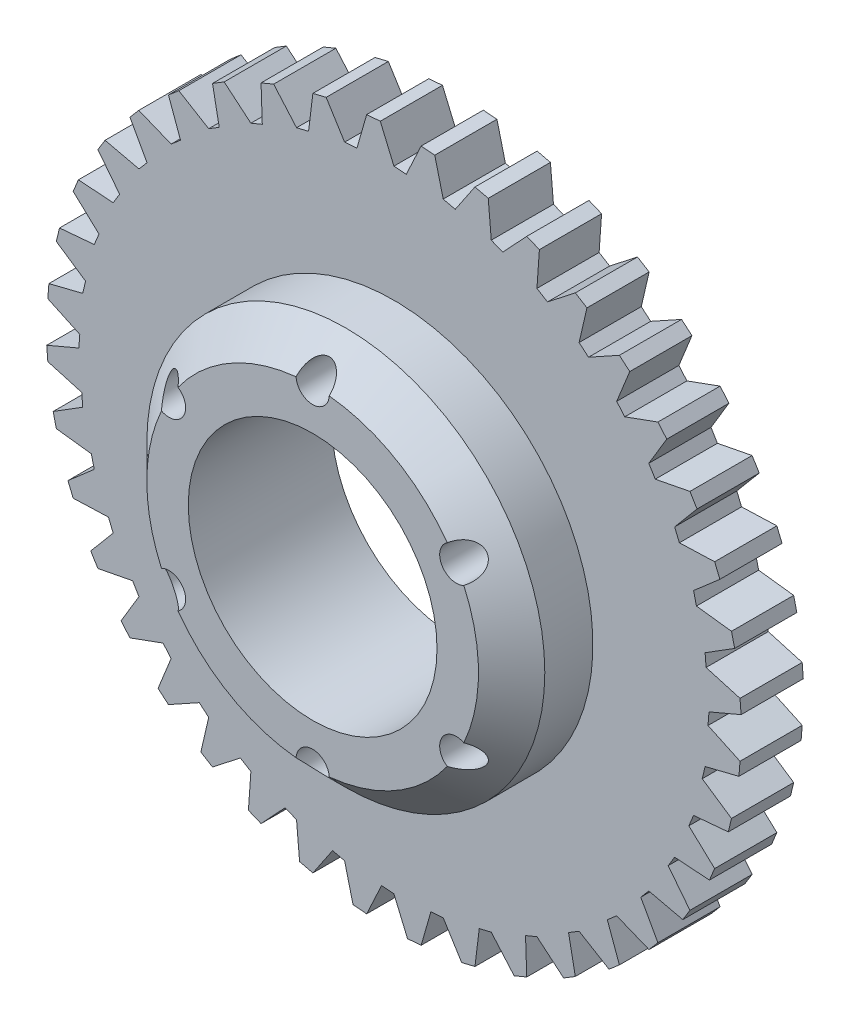
from build123d import *

# Parameters (mm, degrees)
BOSS_EXTRUDE1_DEPTH     = 3750
SCALE1_SCALE            = 0.001
SKETCH5_R               = 12
BOSS_EXTRUDE2_DEPTH     = 4.9
CUT_EXTRUDE1_DEPTH      = 20965.780474234
CUT_EXTRUDE1_DEPTH_BACK = 20965.780474234
SKETCH3_R               = 7.5
SKETCH3_R_2             = 1
CHAMFER1_SIZE           = 2


# Read off the part's stored shape, not the designer's step: Imported1
with BuildPart() as part:
    # Sketch1 → Boss-Extrude1 (new body)
    with BuildSketch(Plane.XY):
        Polygon((2322.933197021, 29515.665054321), (3051.04804039, 27515.468597412), (2484.270811081, 27031.394958496), (535.028636456, 27819.169998169), (-2e-09, 27192.7318573), (1032.050251961, 25331.064224243), (547.976732254, 24764.28604126), (-1500.502228737, 25237.434387207), (-1930.947303772, 24535.011291504), (-620.374023914, 22857.711791992), (-1009.82427597, 22222.185134888), (-3107.0997715, 22369.05670166), (-3422.362327576, 21607.944488525), (-1865.536689758, 20156.312942505), (-2150.774240494, 19467.68951416), (-4245.2044487, 19284.664154053), (-4437.521457672, 18483.606338501), (-2672.77765274, 17293.388366699), (-2846.778869629, 16568.620681763), (-4886.791706085, 16060.209274292), (-4951.427936554, 15238.927841187), (-3022.219896317, 14339.429855347), (-3080.700397491, 13596.36592865), (-5016.064167023, 12775.085449219), (-4951.427936554, 11953.804016113), (-2905.259132385, 11367.175102234), (-2846.778869629, 10624.111175537), (-4629.838466644, 9510.184288025), (-4437.521457672, 8709.126472473), (-2324.775218964, 8449.810028076), (-2150.774240494, 7725.043296814), (-3737.624645233, 6345.898628235), (-3422.362327576, 5584.787845612), (-1295.061826706, 5659.171104431), (-1009.82427597, 4970.546722412), (-2361.392259598, 3360.14342308), (-1930.947303772, 2657.721042633), (158.526480198, 3063.97151947), (547.976732254, 2428.446531296), (-535.028636456, 626.43802166), (0, 0), (2000.197172165, 728.114783764), (2484.270811081, 161.337509751), (1696.495294571, -1787.904620171), (2322.933197021, -2322.933197021), (4184.602737427, -1290.88306427), (4751.379966736, -1774.956583977), (4278.231620789, -3823.435544968), (4980.654239655, -4253.880500793), (6657.955169678, -2943.30739975), (7293.479919434, -3332.757711411), (7146.61026001, -5430.03320694), (7907.721042633, -5745.295524597), (9359.353065491, -4188.46988678), (10047.976493835, -4473.707675934), (10231.000900269, -6568.137645721), (11032.059669495, -6760.454654694), (12222.277641296, -4995.710849762), (12947.044372559, -5169.71206665), (13455.456733704, -7209.724903107), (14276.738166809, -7274.361133575), (15176.236152649, -5345.153331757), (15919.300079346, -5403.633594513), (16740.581512451, -7338.997364044), (17561.861038208, -7274.361133575), (18148.490905762, -5228.192329407), (18891.553878784, -5169.71206665), (20005.481719971, -6952.771663666), (20806.539535522, -6760.454654694), (21065.855026245, -4647.708415985), (21790.622711182, -4473.707675934), (23169.767379761, -6060.557842255), (23930.877685547, -5745.295524597), (23856.494903564, -3617.995023727), (24545.118331909, -3332.757711411), (26155.523300171, -4684.325695038), (26857.944488525, -4253.880500793), (26451.694488525, -2164.406776428), (27087.219238281, -1774.956583977), (28889.228820801, -2857.961893082), (29515.665054321, -2322.933197021), (28787.551879883, -322.735995054), (29354.328155518, 161.337509751), (31303.569793701, -626.43802166), (31838.600158691, 3e-09), (30806.549072266, 1861.669301987), (31290.622711182, 2428.446531296), (33339.099884033, 1955.298542976), (33769.546508789, 2657.721042633), (32458.972930908, 4335.021972656), (32848.42300415, 4970.546722412), (34945.697784424, 4823.676586151), (35260.963439941, 5584.787845612), (33704.135894775, 7036.419391632), (33989.372253418, 7725.043296814), (36083.805084229, 7908.067703247), (36276.119232178, 8709.126472473), (34511.375427246, 9899.344444275), (34685.37902832, 10624.111175537), (36725.391387939, 11132.523536682), (36790.027618408, 11953.804016113), (34860.820770264, 12853.302955627), (34919.300079346, 13596.36592865), (36854.663848877, 14417.647361755), (36790.027618408, 15238.927841187), (34743.858337402, 15825.55770874), (34685.37902832, 16568.620681763), (36468.437194824, 17682.548522949), (36276.119232178, 18483.606338501), (34163.375854492, 18742.921829224), (33989.372253418, 19467.68951416), (35576.225280762, 20846.834182739), (35260.963439941, 21607.944488525), (33133.659362793, 21533.561706543), (32848.42300415, 22222.185134888), (34199.993133545, 23832.590103149), (33769.546508789, 24535.011291504), (31680.072784424, 24128.761291504), (31290.622711182, 24764.28604126), (32373.626708984, 26566.295623779), (31838.600158691, 27192.7318573), (29838.401794434, 26464.618682861), (29354.328155518, 27031.394958496), (30142.10319519, 28980.63659668), (29515.665054321, 29515.665054321), (27653.997421265, 28483.615875244), (27087.219238281, 28967.68951416), (27560.367584229, 31016.16859436), (26857.944488525, 31446.613311768), (25180.644989014, 30136.039733887), (24545.118331909, 30525.489807129), (24691.989898682, 32622.764587402), (23930.877685547, 32938.026428223), (22479.246139526, 31381.202697754), (21790.622711182, 31666.440963745), (21607.597351074, 33760.871887207), (20806.539535522, 33953.186035156), (19616.321563721, 32188.442230225), (18891.553878784, 32362.445831299), (18383.142471313, 34402.458190918), (17561.861038208, 34467.094421387), (16662.363052368, 32537.887573242), (15919.300079346, 32596.366882324), (15098.01864624, 34531.730651855), (14276.738166809, 34467.094421387), (13690.108299255, 32420.925140381), (12947.044372559, 32362.445831299), (11833.117485046, 34145.503997803), (11032.059669495, 33953.186035156), (10772.744178772, 31840.440750122), (10047.976493835, 31666.440963745), (8668.831825256, 33253.29208374), (7907.721042633, 32938.026428223), (7982.104301453, 30810.72807312), (7293.479919434, 30525.489807129), (5683.076858521, 31877.058029175), (4980.654239655, 31446.613311768), (5386.904716492, 29357.139587402), (4751.379966736, 28967.68951416), (2949.371337891, 30050.695419312), align=None)
    extrude(amount=BOSS_EXTRUDE1_DEPTH)


with BuildPart() as part_1:
    # Scale1: scaled about (15919.299614508, 13596.366319382, 1875)
    add(part.part.scale(SCALE1_SCALE).moved(Location((15903.380314893, 13582.769953063, 1873.125))))

    # Sketch5 → Boss-Extrude2 (add)
    with BuildSketch(Plane.XY.offset(1876.875)):
        with Locations(Location((15919.299613925, 13596.366319737, 0), (0, 0, 180))):
            Circle(SKETCH5_R)
    extrude(amount=BOSS_EXTRUDE2_DEPTH)

    # Sketch3 → Cut-Extrude1 (cut, two sides: drawn at the far end of the back side and taken through both)
    with BuildSketch(Plane.XY.offset(1876.875).offset(-CUT_EXTRUDE1_DEPTH_BACK)):
        with Locations((15919.299613925, 13596.366319737)):
            Circle(SKETCH3_R)
        with Locations((15919.299613925, 13606.366319737)):
            Circle(SKETCH3_R_2)
        with Locations((15910.639359887, 13601.366319737)):
            Circle(SKETCH3_R_2)
        with Locations((15910.639359887, 13591.366319737)):
            Circle(SKETCH3_R_2)
        with Locations((15919.299613925, 13586.366319737)):
            Circle(SKETCH3_R_2)
        with Locations((15927.959867963, 13591.366319737)):
            Circle(SKETCH3_R_2)
        with Locations((15927.959867963, 13601.366319737)):
            Circle(SKETCH3_R_2)
    extrude(amount=CUT_EXTRUDE1_DEPTH + CUT_EXTRUDE1_DEPTH_BACK, mode=Mode.SUBTRACT)

    # Chamfer1
    # the kernel refuses this chamfer: 2 mm, written as the material it takes off along each edge
    with BuildSketch(Plane(origin=(15919.299613925, 13596.366319737, 1881.775), x_dir=(-1, 0, 0), z_dir=(0, 1, 0))) as chamfer1_piece_1:
        Polygon((12, -CHAMFER1_SIZE), (12 - CHAMFER1_SIZE, 0), (12, 0), align=None)
    revolve(axis=Axis((15919.299613925, 13596.366319737, 1881.775), (0, 0, 1)), mode=Mode.SUBTRACT)


solid = part_1.part
